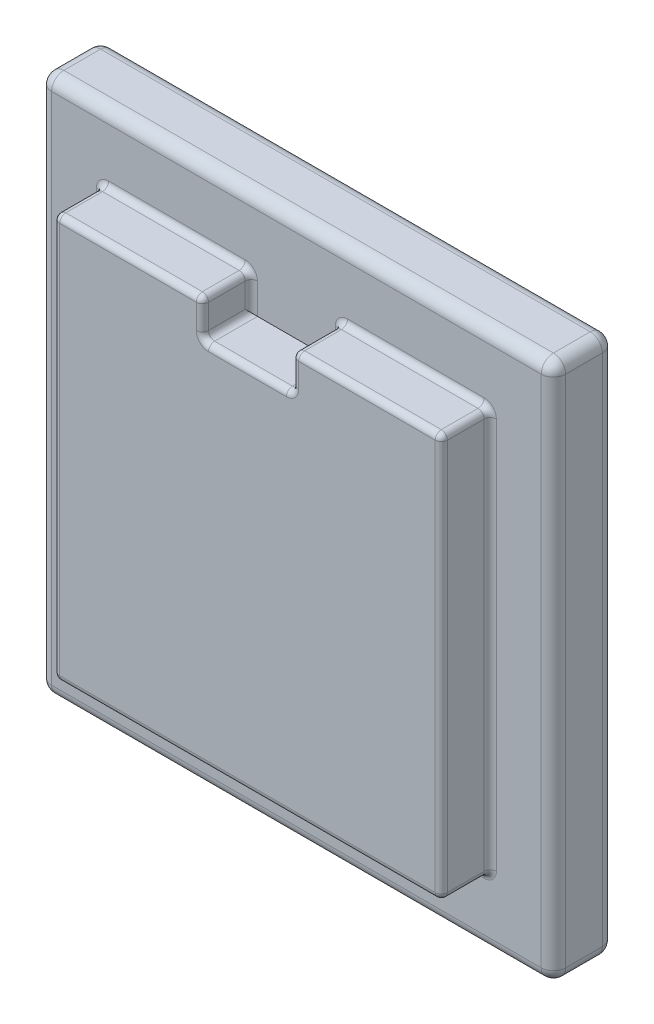
from build123d import *

# Parameters (mm, degrees)
BOSS_EXTRUDE1_DEPTH = 6.35
SKETCH2_W           = 66.675
SKETCH2_H           = 69.85
BOSS_EXTRUDE2_DEPTH = 3.175
SKETCH3_W           = 66.675
SKETCH3_H           = 69.85
BOSS_EXTRUDE3_DEPTH = 4.7625
FILLET1_R           = 1.5875
FILLET2_R           = 0.79375


with BuildPart() as part:
    # Sketch1 → Boss-Extrude1 (new body)
    with BuildSketch(Plane.XY):
        Polygon((-25.146, 26.19375), (-15.494, 26.19375), (-5.842, 26.19375), (-5.842, 21.43125), (5.842, 21.43125), (5.842, 26.19375), (15.494, 26.19375), (25.146, 26.19375), (25.146, -26.19375), (-25.146, -26.19375), align=None)
    extrude(amount=BOSS_EXTRUDE1_DEPTH)

    # Sketch2 → Boss-Extrude2 (add)
    with BuildSketch(Plane.XY):
        Rectangle(SKETCH2_W, SKETCH2_H)
    extrude(amount=-BOSS_EXTRUDE2_DEPTH)

    # Sketch3 → Boss-Extrude3 (add)
    with BuildSketch(Plane(origin=(0, 0, -3.175), x_dir=(-1, 0, 0), z_dir=(0, 0, -1))):
        Rectangle(SKETCH3_W, SKETCH3_H)
        Polygon((5.715, 27.305), (24.892, 27.305), (24.892, -27.305), (-24.892, -27.305), (-24.892, 27.305), (-5.715, 27.305), (-5.715, 22.733), (5.715, 22.733), align=None, mode=Mode.SUBTRACT)
    extrude(amount=BOSS_EXTRUDE3_DEPTH)

    # Fillet1
    fillet1_edges = [part.edges().sort_by_distance(p)[0] for p in [
        (33.3375, 34.925, -3.96875),
        (33.3375, -34.925, -3.96875),
        (-33.3375, -34.925, -3.96875),
        (-33.3375, 34.925, -3.96875),
        (33.3375, 0, 0),
        (0, 34.925, 0),
        (0, -34.925, 0),
        (-33.3375, 0, 0),
        (33.3375, 0, -7.9375),
        (0, 34.925, -7.9375),
        (0, -34.925, -7.9375),
        (-33.3375, 0, -7.9375),
    ]]
    fillet(fillet1_edges, radius=FILLET1_R)

    # Fillet2
    fillet2_edges = [part.edges().sort_by_distance(p)[0] for p in [
        (5.842, 26.19375, 3.175),
        (25.146, 26.19375, 3.175),
        (25.146, 0, 6.35),
        (0, -26.19375, 6.35),
        (-25.146, 0, 6.35),
        (-15.494, 26.19375, 6.35),
        (-5.842, 23.8125, 6.35),
        (0, 21.43125, 6.35),
        (5.842, 23.8125, 6.35),
        (15.494, 26.19375, 6.35),
        (-5.842, 26.19375, 3.175),
        (-5.842, 21.43125, 3.175),
        (5.842, 21.43125, 3.175),
        (25.146, -26.19375, 3.175),
        (-25.146, 26.19375, 3.175),
        (-25.146, -26.19375, 3.175),
        (-5.842, 23.8125, 0),
        (-15.494, 26.19375, 0),
        (-25.146, 0, 0),
        (0, -26.19375, 0),
        (25.146, 0, 0),
        (5.842, 23.8125, 0),
        (15.494, 26.19375, 0),
        (-5.715, 25.019, -7.9375),
        (15.3035, 27.305, -7.9375),
        (24.892, 0, -7.9375),
        (24.892, 27.305, -5.55625),
        (0, -27.305, -7.9375),
        (24.892, -27.305, -5.55625),
        (-24.892, 0, -7.9375),
        (-24.892, -27.305, -5.55625),
        (-5.715, 27.305, -5.55625),
        (-15.3035, 27.305, -7.9375),
        (-24.892, 27.305, -5.55625),
        (0, 22.733, -7.9375),
        (-5.715, 22.733, -5.55625),
        (5.715, 27.305, -5.55625),
        (5.715, 25.019, -7.9375),
        (5.715, 22.733, -5.55625),
        (24.892, 0, -3.175),
        (15.3035, 27.305, -3.175),
        (5.715, 25.019, -3.175),
        (0, 22.733, -3.175),
        (-5.715, 25.019, -3.175),
        (-15.3035, 27.305, -3.175),
        (-24.892, 0, -3.175),
        (0, -27.305, -3.175),
    ]]
    fillet(fillet2_edges, radius=FILLET2_R)


solid = part.part
